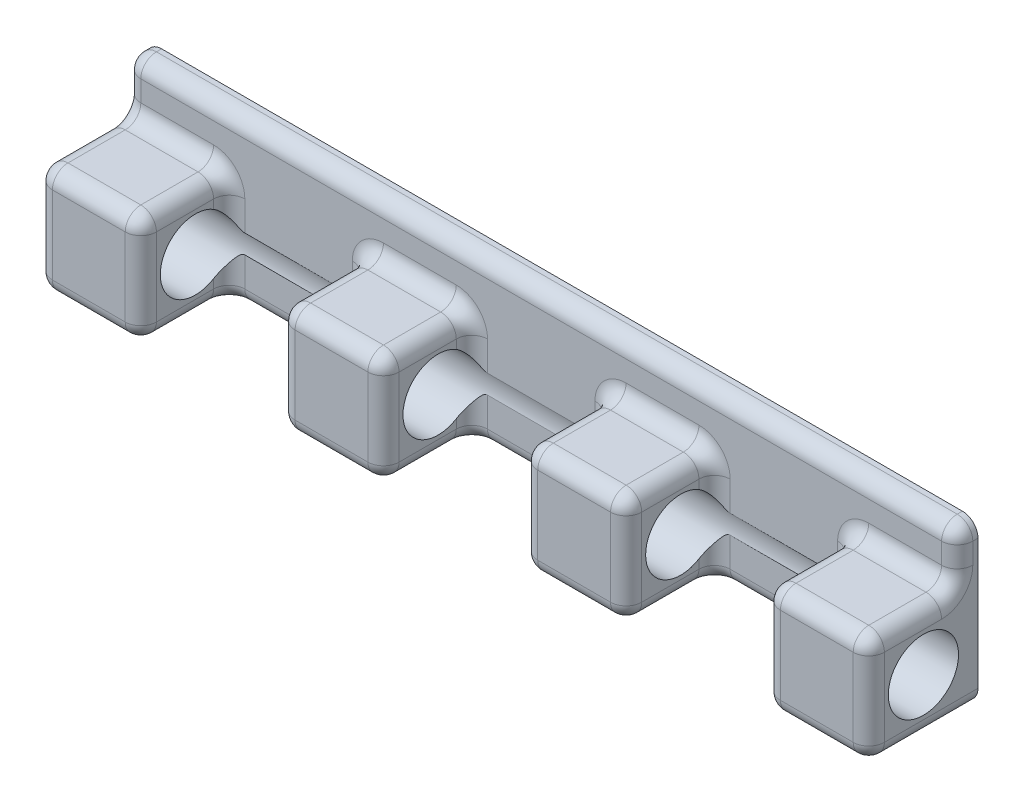
from build123d import *

# Parameters (mm, degrees)
SKETCH1_W           = 160
SKETCH1_H           = 21
BOSS_EXTRUDE1_DEPTH = 21
SKETCH2_W           = 26.666666667
SKETCH2_H           = 21
SKETCH2_W_2         = 26.666666666
CUT_EXTRUDE1_DEPTH  = 17
SKETCH3_R           = 6.75
CUT_EXTRUDE2_DEPTH  = 169
SKETCH4_W           = 160
SKETCH4_H           = 10
BOSS_EXTRUDE2_DEPTH = 4
FILLET1_R           = 3
CUT_EXTRUDE3_DEPTH  = 0.5


# Read off the part's stored shape, not the designer's step: Cut-Extrude3
with BuildPart() as part:
    # Sketch1 → Boss-Extrude1 (new body)
    with BuildSketch(Plane.XY):
        with Locations((80, 10.5)):
            Rectangle(SKETCH1_W, SKETCH1_H)
    extrude(amount=BOSS_EXTRUDE1_DEPTH)

    # Sketch2 → Cut-Extrude1 (cut)
    with BuildSketch(Plane.XY.offset(21)):
        with Locations((33.333333334, 10.5)):
            Rectangle(SKETCH2_W, SKETCH2_H)
        with Locations((80, 10.5)):
            Rectangle(SKETCH2_W_2, SKETCH2_H)
        with Locations((126.666666667, 10.5)):
            Rectangle(SKETCH2_W, SKETCH2_H)
    extrude(amount=-CUT_EXTRUDE1_DEPTH, mode=Mode.SUBTRACT)

    # Sketch3 → Cut-Extrude2 (cut)
    with BuildSketch(Plane(origin=(160, 0, 0), x_dir=(0, 0, -1), z_dir=(1, 0, 0))):
        with Locations((-10.5, 10.5)):
            Circle(SKETCH3_R)
    extrude(amount=-CUT_EXTRUDE2_DEPTH, mode=Mode.SUBTRACT)

    # Sketch4 → Boss-Extrude2 (add)
    with BuildSketch(Plane(origin=(0, 0, 0), x_dir=(-1, 0, 0), z_dir=(0, 0, -1))):
        with Locations((-80, 26)):
            Rectangle(SKETCH4_W, SKETCH4_H)
    extrude(amount=-BOSS_EXTRUDE2_DEPTH)

    # Fillet1
    fillet1_edges = [part.edges().sort_by_distance(p)[0] for p in [
        (160, 10.5, 21),
        (56.666666667, 0, 21),
        (103.333333333, 0, 21),
        (150, 0, 21),
        (150, 21, 21),
        (103.333333333, 21, 21),
        (56.666666667, 21, 21),
        (10, 21, 21),
        (46.666666667, 10.5, 21),
        (46.666666667, 21, 12.5),
        (33.333333333, 0, 4),
        (46.666666667, 0, 12.5),
        (20, 16.660013736, 4),
        (20, 0, 12.5),
        (20, 21, 12.5),
        (46.666666667, 16.660013736, 4),
        (20, 10.5, 21),
        (93.333333333, 10.5, 21),
        (93.333333333, 21, 12.5),
        (80, 0, 4),
        (93.333333333, 0, 12.5),
        (66.666666667, 16.660013736, 4),
        (66.666666667, 0, 12.5),
        (66.666666667, 21, 12.5),
        (93.333333333, 16.660013736, 4),
        (66.666666667, 10.5, 21),
        (113.333333333, 21, 12.5),
        (140, 10.5, 21),
        (140, 21, 12.5),
        (126.666666667, 0, 4),
        (140, 0, 12.5),
        (113.333333333, 16.660013736, 4),
        (113.333333333, 0, 12.5),
        (140, 16.660013736, 4),
        (113.333333333, 10.5, 21),
        (0, 10.5, 21),
        (46.666666667, 4.339986264, 4),
        (20, 4.339986264, 4),
        (93.333333333, 4.339986264, 4),
        (66.666666667, 4.339986264, 4),
        (113.333333333, 4.339986264, 4),
        (140, 4.339986264, 4),
        (0, 21, 12.5),
        (160, 21, 12.5),
        (160, 0, 10.5),
        (0, 0, 10.5),
        (10, 0, 21),
        (10, 21, 4),
        (56.666666667, 21, 4),
        (103.333333333, 21, 4),
        (150, 21, 4),
        (0, 26, 4),
        (0, 31, 2),
        (80, 31, 4),
        (160, 31, 2),
        (160, 26, 4),
    ]]
    fillet(fillet1_edges, radius=FILLET1_R)

    # Cut-Extrude3 outline → Cut-Extrude3 (cut)
    with BuildSketch(Plane(origin=(0, 0, 0), x_dir=(1, 0, 0), z_dir=(0, 1, 0))):
        with BuildLine():
            Line((10.225140381, -1.741040039), (11.579854202, -2.662515608))
            add(Edge.make_bspline(
                [(11.579854202, -2.662515608), (11.630566755, -2.697592149), (11.728738404, -2.765494899), (11.867267216, -2.868674288), (11.993677177, -2.968049032), (12.106143288, -3.06519925), (12.206159151, -3.158991632), (12.293382226, -3.249324007), (12.367258683, -3.337344146), (12.446299421, -3.44788036), (12.523523078, -3.582188046), (12.593593875, -3.738441669), (12.637491183, -3.889424332), (12.643275063, -3.988669529), (12.646064154, -4.036527348)],
                knots=[0, 0, 0, 0, 0.102488525, 0.198401914, 0.287074603, 0.369708942, 0.44535091, 0.514926661, 0.578313457, 0.636174539, 0.740618928, 0.835181779, 0.920521691, 1, 1, 1, 1], degree=3))
            add(Edge.make_bspline(
                [(12.646064154, -4.036527348), (12.645702105, -4.063908372), (12.644987876, -4.117924058), (12.633546773, -4.196910733), (12.617485501, -4.272900397), (12.594368317, -4.345382221), (12.564075787, -4.414443132), (12.527513859, -4.480232221), (12.48354049, -4.542386949), (12.43363782, -4.600666003), (12.379344296, -4.654646125), (12.320162089, -4.701383536), (12.256362762, -4.740198452), (12.189355905, -4.773009863), (12.117905952, -4.798633049), (12.042650961, -4.815334257), (11.96356848, -4.826485721), (11.90956705, -4.827953804), (11.881866614, -4.828706868)],
                knots=[0, 0, 0, 0, 0.06659456, 0.131373857, 0.193879822, 0.255536535, 0.31619585, 0.377187768, 0.438445469, 0.501205922, 0.563770706, 0.624546135, 0.684304329, 0.745235909, 0.805910381, 0.86858775, 0.932591105, 1, 1, 1, 1], degree=3))
            add(Edge.make_bspline(
                [(11.881866614, -4.828706868), (11.851603618, -4.82792593), (11.792814643, -4.826408876), (11.706816897, -4.81575605), (11.626089791, -4.797455161), (11.549846384, -4.772522536), (11.479238911, -4.739284098), (11.412847051, -4.699736405), (11.352074103, -4.651949686), (11.29542113, -4.597630402), (11.244579155, -4.535398809), (11.197551068, -4.466725297), (11.157830669, -4.389649902), (11.120366202, -4.306681186), (11.090208543, -4.215601634), (11.06402312, -4.117681991), (11.04284507, -4.012602223), (11.032991058, -3.939780547), (11.027933757, -3.90240682)],
                knots=[0, 0, 0, 0, 0.064616556, 0.125524294, 0.184671911, 0.241139137, 0.296445882, 0.350979668, 0.405793836, 0.461164507, 0.518234122, 0.577093953, 0.63854139, 0.703114134, 0.771310552, 0.843111998, 0.919481536, 1, 1, 1, 1], degree=3))
            Line((11.027933757, -3.90240682), (10.225140381, -4.087666829))
            add(Edge.make_bspline(
                [(10.225140381, -4.087666829), (10.233356596, -4.135756221), (10.249657865, -4.231167314), (10.287786133, -4.370215026), (10.335934136, -4.503921524), (10.395322482, -4.631915459), (10.464872029, -4.755190338), (10.546233076, -4.872535726), (10.63752486, -4.985383167), (10.738878893, -5.091917708), (10.8503588, -5.189217836), (10.970763119, -5.274838911), (11.099420801, -5.347369981), (11.236487945, -5.406737386), (11.382198365, -5.45180965), (11.535867652, -5.484625423), (11.698038153, -5.504079137), (11.808802972, -5.50666884), (11.865463384, -5.507993571)],
                knots=[0, 0, 0, 0, 0.061474734, 0.121968095, 0.181484621, 0.240447441, 0.299644032, 0.359705053, 0.42024596, 0.482480917, 0.544847828, 0.60650283, 0.668415966, 0.730710337, 0.794448858, 0.860378466, 0.928578281, 1, 1, 1, 1], degree=3))
            add(Edge.make_bspline(
                [(11.865463384, -5.507993571), (11.924053851, -5.506671537), (12.038666966, -5.504085409), (12.206256658, -5.484598797), (12.36498536, -5.452236501), (12.514175381, -5.40564077), (12.654452605, -5.346761428), (12.785089627, -5.273739539), (12.90768456, -5.188898988), (13.018852544, -5.090019552), (13.120214713, -4.982605988), (13.208497943, -4.866633472), (13.281975275, -4.742891952), (13.343545484, -4.612957074), (13.390705345, -4.47533985), (13.424355032, -4.33084831), (13.445204999, -4.179296608), (13.447623119, -4.075834517), (13.44885753, -4.023018805)],
                knots=[0, 0, 0, 0, 0.072015998, 0.140875782, 0.207100257, 0.2708811, 0.332716646, 0.393780021, 0.454548246, 0.515624421, 0.576327007, 0.635875079, 0.694395607, 0.752942845, 0.812338446, 0.872856601, 0.935095366, 1, 1, 1, 1], degree=3))
            add(Edge.make_bspline(
                [(13.44885753, -4.023018805), (13.447739548, -3.976013307), (13.445526438, -3.882963161), (13.428021048, -3.745241105), (13.397452852, -3.611881025), (13.35753903, -3.481582552), (13.303244302, -3.356042514), (13.240335391, -3.232824233), (13.16303036, -3.114981342), (13.089590857, -3.019406548), (13.022124064, -2.942691774), (12.96168416, -2.882061493), (12.893430809, -2.817376745), (12.815711114, -2.750033044), (12.730119685, -2.678554861), (12.635483849, -2.604704135), (12.532715835, -2.526949195), (12.420776063, -2.446323008), (12.300419092, -2.361347689), (12.171083797, -2.273554638), (12.032870826, -2.18336405), (11.887230164, -2.088019546), (11.731610264, -1.991157843), (11.568057933, -1.889905782), (11.395695413, -1.785304904), (11.277580895, -1.715207814), (11.21705335, -1.679286702)],
                knots=[0, 0, 0, 0, 0.041495428, 0.082142639, 0.122307868, 0.162185965, 0.202270804, 0.242915039, 0.284189302, 0.326505472, 0.349239486, 0.37434042, 0.402062602, 0.432249619, 0.465118487, 0.500510775, 0.538222901, 0.578893913, 0.622305037, 0.668302943, 0.716899285, 0.768018831, 0.821990626, 0.878732468, 0.937856699, 1, 1, 1, 1], degree=3))
            Line((11.21705335, -1.679286702), (13.436313883, -1.679286702))
            Line((13.436313883, -1.679286702), (13.436313883, -1))
            Line((13.436313883, -1), (10.225140381, -1))
            Line((10.225140381, -1), (10.225140381, -1.741040039))
        make_face()
        Polygon((8.537537479, -1), (7.723165353, -1), (6.319241842, -5.446240234), (7.166420428, -5.446240234), (8.218156942, -2.115419642), (9.263139184, -5.446240234), (9.931812032, -5.446240234), align=None)
    extrude(amount=CUT_EXTRUDE3_DEPTH, mode=Mode.SUBTRACT)


solid = part.part
